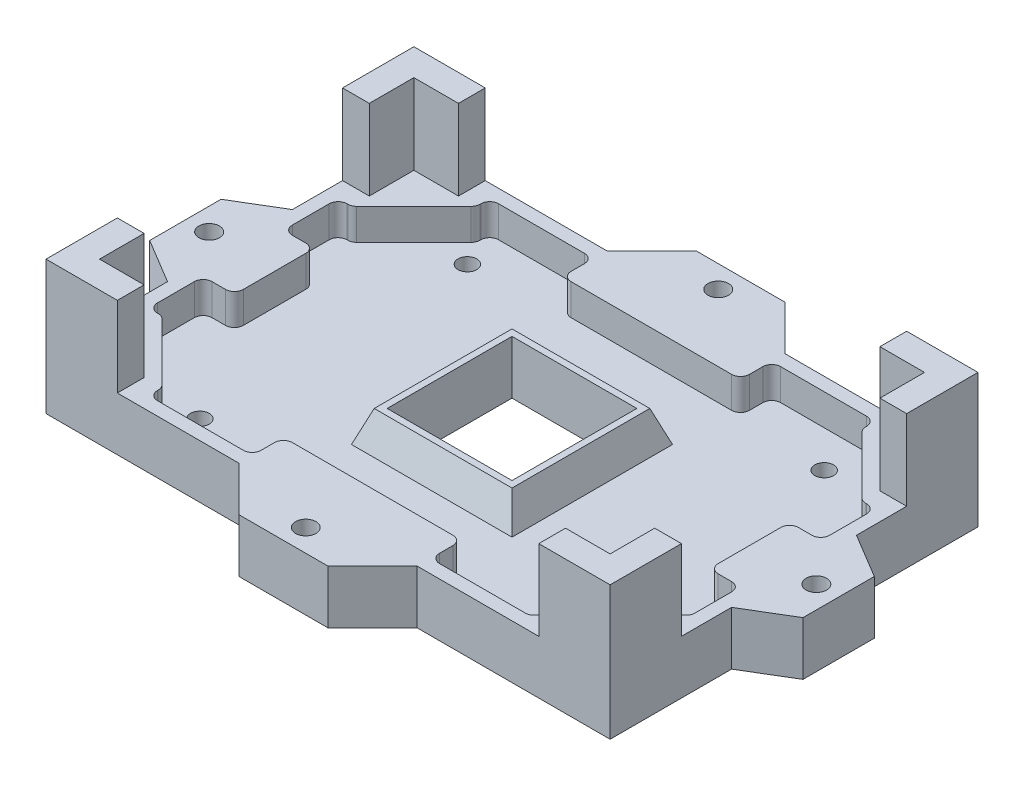
from build123d import *
from OCP.BRepFilletAPI import BRepFilletAPI_MakeChamfer

# Parameters (mm, degrees)
SKETCH_1_W       = 126.5
SKETCH_1_H       = 82.5
SKETCH_1_R       = 2.1
SKETCH_1_W_2     = 28
SKETCH_1_H_2     = 28
EXTRUDE_1_DEPTH  = 5
SKETCH_2_W       = 23.25
SKETCH_2_H       = 3
SKETCH_2_W_2     = 40
SKETCH_2_H_2     = 10
SKETCH_2_W_3     = 3
SKETCH_2_H_3     = 12.25
SKETCH_2_W_4     = 10
SKETCH_2_H_4     = 18
SKETCH_2_W_5     = 36
SKETCH_2_H_5     = 36
SKETCH_2_W_6     = 28
SKETCH_2_H_6     = 28
EXTRUDE_2_DEPTH  = 7
CHAMFER_1_SIZE   = 2.54779164
CHAMFER_1_SIZE_2 = 7
FILLET_1_R       = 2
EXTRUDE_3_DEPTH  = 18
SKETCH_4_W       = 20
SKETCH_4_H       = 10
SKETCH_4_R       = 2.3
SKETCH_4_W_2     = 10
SKETCH_4_H_2     = 16
EXTRUDE_4_DEPTH  = 12


with BuildPart() as part:
    # Эскиз1 → Бобышка-Вытянуть1 (new body)
    with BuildSketch(Plane(origin=(0, 77.195974268, 0), x_dir=(1, 0, 0), z_dir=(0, 1, 0))):
        with Locations((64.808980694, -89.523129836)):
            Rectangle(SKETCH_1_W, SKETCH_1_H)
        with Locations(Location((24.808980694, -59.523129836, 0), (0, 0, 180))):
            Circle(SKETCH_1_R, mode=Mode.SUBTRACT)
        with Locations(Location((104.808980694, -59.523129836, 0), (0, 0, 180))):
            Circle(SKETCH_1_R, mode=Mode.SUBTRACT)
        with Locations(Location((104.808980694, -119.523129836, 0), (0, 0, 180))):
            Circle(SKETCH_1_R, mode=Mode.SUBTRACT)
        with Locations(Location((24.808980694, -119.523129836, 0), (0, 0, 180))):
            Circle(SKETCH_1_R, mode=Mode.SUBTRACT)
        with Locations((64.808980694, -89.523129836)):
            Rectangle(SKETCH_1_W_2, SKETCH_1_H_2, mode=Mode.SUBTRACT)
    extrude(amount=EXTRUDE_1_DEPTH)

    # Эскиз2 → Бобышка-Вытянуть2 (add)
    # profile 1 of 17: a face of its own
    with BuildSketch(Plane(origin=(0, 82.195974268, 0), x_dir=(1, 0, 0), z_dir=(0, 1, 0))):
        Polygon((1.558980694, -68.273129836), (7.558980694, -68.273129836), (21.558980694, -54.273129836), (21.558980694, -48.273129836), (1.558980694, -48.273129836), align=None)
    # profile 2 of 17: a face of its own
    with BuildSketch(Plane(origin=(0, 82.195974268, 0), x_dir=(1, 0, 0), z_dir=(0, 1, 0))):
        with Locations((33.183980694, -49.773129836)):
            Rectangle(SKETCH_2_W, SKETCH_2_H)
    # profile 3 of 17: a face of its own
    with BuildSketch(Plane(origin=(0, 82.195974268, 0), x_dir=(1, 0, 0), z_dir=(0, 1, 0))):
        with Locations((64.808980694, -53.273129836)):
            Rectangle(SKETCH_2_W_2, SKETCH_2_H_2)
    # profile 4 of 17: a face of its own
    with BuildSketch(Plane(origin=(0, 82.195974268, 0), x_dir=(1, 0, 0), z_dir=(0, 1, 0))):
        with Locations((96.433980694, -49.773129836)):
            Rectangle(SKETCH_2_W, SKETCH_2_H)
    # profile 5 of 17: a face of its own
    with BuildSketch(Plane(origin=(0, 82.195974268, 0), x_dir=(1, 0, 0), z_dir=(0, 1, 0))):
        Polygon((122.058980694, -68.273129836), (108.058980694, -54.273129836), (108.058980694, -48.273129836), (128.058980694, -48.273129836), (128.058980694, -68.273129836), align=None)
    # profile 6 of 17: a face of its own
    with BuildSketch(Plane(origin=(0, 82.195974268, 0), x_dir=(1, 0, 0), z_dir=(0, 1, 0))):
        with Locations((126.558980694, -74.398129836)):
            Rectangle(SKETCH_2_W_3, SKETCH_2_H_3)
    # profile 7 of 17: a face of its own
    with BuildSketch(Plane(origin=(0, 82.195974268, 0), x_dir=(1, 0, 0), z_dir=(0, 1, 0))):
        with Locations((123.058980694, -89.523129836)):
            Rectangle(SKETCH_2_W_4, SKETCH_2_H_4)
    # profile 8 of 17: a face of its own
    with BuildSketch(Plane(origin=(0, 82.195974268, 0), x_dir=(1, 0, 0), z_dir=(0, 1, 0))):
        with Locations((126.558980694, -104.648129836)):
            Rectangle(SKETCH_2_W_3, SKETCH_2_H_3)
    # profile 9 of 17: a face of its own
    with BuildSketch(Plane(origin=(0, 82.195974268, 0), x_dir=(1, 0, 0), z_dir=(0, 1, 0))):
        Polygon((108.058980694, -124.773129836), (122.058980694, -110.773129836), (128.058980694, -110.773129836), (128.058980694, -130.773129836), (108.058980694, -130.773129836), align=None)
    # profile 10 of 17: a face of its own
    with BuildSketch(Plane(origin=(0, 82.195974268, 0), x_dir=(1, 0, 0), z_dir=(0, 1, 0))):
        with Locations((96.433980694, -129.273129836)):
            Rectangle(SKETCH_2_W, SKETCH_2_H)
    # profile 11 of 17: a face of its own
    with BuildSketch(Plane(origin=(0, 82.195974268, 0), x_dir=(1, 0, 0), z_dir=(0, 1, 0))):
        with Locations((64.808980694, -89.523129836)):
            Rectangle(SKETCH_2_W_5, SKETCH_2_H_5)
        with Locations((64.808980694, -89.523129836)):
            Rectangle(SKETCH_2_W_6, SKETCH_2_H_6, mode=Mode.SUBTRACT)
    # profile 12 of 17: a face of its own
    with BuildSketch(Plane(origin=(0, 82.195974268, 0), x_dir=(1, 0, 0), z_dir=(0, 1, 0))):
        with Locations((64.808980694, -125.773129836)):
            Rectangle(SKETCH_2_W_2, SKETCH_2_H_2)
    # profile 13 of 17: a face of its own
    with BuildSketch(Plane(origin=(0, 82.195974268, 0), x_dir=(1, 0, 0), z_dir=(0, 1, 0))):
        with Locations((33.183980694, -129.273129836)):
            Rectangle(SKETCH_2_W, SKETCH_2_H)
    # profile 14 of 17: a face of its own
    with BuildSketch(Plane(origin=(0, 82.195974268, 0), x_dir=(1, 0, 0), z_dir=(0, 1, 0))):
        Polygon((7.558980694, -110.773129836), (21.558980694, -124.773129836), (21.558980694, -130.773129836), (1.558980694, -130.773129836), (1.558980694, -110.773129836), align=None)
    # profile 15 of 17: a face of its own
    with BuildSketch(Plane(origin=(0, 82.195974268, 0), x_dir=(1, 0, 0), z_dir=(0, 1, 0))):
        with Locations((3.058980694, -104.648129836)):
            Rectangle(SKETCH_2_W_3, SKETCH_2_H_3)
    # profile 16 of 17: a face of its own
    with BuildSketch(Plane(origin=(0, 82.195974268, 0), x_dir=(1, 0, 0), z_dir=(0, 1, 0))):
        with Locations((6.558980694, -89.523129836)):
            Rectangle(SKETCH_2_W_4, SKETCH_2_H_4)
    # profile 17 of 17: a face of its own
    with BuildSketch(Plane(origin=(0, 82.195974268, 0), x_dir=(1, 0, 0), z_dir=(0, 1, 0))):
        with Locations((3.058980694, -74.398129836)):
            Rectangle(SKETCH_2_W_3, SKETCH_2_H_3)
    extrude(amount=EXTRUDE_2_DEPTH)

    # Фаска1
    chamfer_1_edges_1 = [part.edges().sort_by_distance(p)[0] for p in [
        (82.808980694, 89.195974268, 89.523129836),
    ]]
    chamfer_1_side_1 = [part.faces().sort_by_distance(p)[0] for p in [
        (82.758024861, 89.195974268, 89.523129836),
    ]]
    chamfer_1_edges_2 = [part.edges().sort_by_distance(p)[0] for p in [
        (64.808980694, 89.195974268, 71.523129836),
    ]]
    chamfer_1_side_2 = [part.faces().sort_by_distance(p)[0] for p in [
        (64.808980694, 89.195974268, 71.574085669),
    ]]
    chamfer_1_edges_3 = [part.edges().sort_by_distance(p)[0] for p in [
        (46.808980694, 89.195974268, 89.523129836),
    ]]
    chamfer_1_side_3 = [part.faces().sort_by_distance(p)[0] for p in [
        (46.859936527, 89.195974268, 89.523129836),
    ]]
    chamfer_1_edges_4 = [part.edges().sort_by_distance(p)[0] for p in [
        (64.808980694, 89.195974268, 107.523129836),
    ]]
    chamfer_1_side_4 = [part.faces().sort_by_distance(p)[0] for p in [
        (64.808980694, 89.195974268, 107.472174004),
    ]]
    chamfer_1 = BRepFilletAPI_MakeChamfer(part.part.solid().wrapped)
    for e in chamfer_1_edges_1:
        chamfer_1.Add(CHAMFER_1_SIZE - 0.0001, CHAMFER_1_SIZE_2 - 0.0001, e.wrapped, chamfer_1_side_1[0].wrapped)
    for e in chamfer_1_edges_2:
        chamfer_1.Add(CHAMFER_1_SIZE - 0.0001, CHAMFER_1_SIZE_2 - 0.0001, e.wrapped, chamfer_1_side_2[0].wrapped)
    for e in chamfer_1_edges_3:
        chamfer_1.Add(CHAMFER_1_SIZE - 0.0001, CHAMFER_1_SIZE_2 - 0.0001, e.wrapped, chamfer_1_side_3[0].wrapped)
    for e in chamfer_1_edges_4:
        chamfer_1.Add(CHAMFER_1_SIZE - 0.0001, CHAMFER_1_SIZE_2 - 0.0001, e.wrapped, chamfer_1_side_4[0].wrapped)
    add(Compound.cast(chamfer_1.Shape()), mode=Mode.REPLACE)  # a hair under: the kernel refuses the full size

    # Скругление1
    fillet_1_edges = [part.edges().sort_by_distance(p)[0] for p in [
        (108.058980694, 85.695974268, 124.773129836),
        (108.058980694, 85.695974268, 127.773129836),
        (84.808980694, 85.695974268, 127.773129836),
        (84.808980694, 85.695974268, 120.773129836),
        (44.808980694, 85.695974268, 120.773129836),
        (44.808980694, 85.695974268, 127.773129836),
        (21.558980694, 85.695974268, 127.773129836),
        (21.558980694, 85.695974268, 124.773129836),
        (7.558980694, 85.695974268, 110.773129836),
        (4.558980694, 85.695974268, 110.773129836),
        (4.558980694, 85.695974268, 98.523129836),
        (11.558980694, 85.695974268, 98.523129836),
        (11.558980694, 85.695974268, 80.523129836),
        (4.558980694, 85.695974268, 80.523129836),
        (4.558980694, 85.695974268, 68.273129836),
        (7.558980694, 85.695974268, 68.273129836),
        (21.558980694, 85.695974268, 54.273129836),
        (21.558980694, 85.695974268, 51.273129836),
        (44.808980694, 85.695974268, 51.273129836),
        (44.808980694, 85.695974268, 58.273129836),
        (84.808980694, 85.695974268, 58.273129836),
        (84.808980694, 85.695974268, 51.273129836),
        (108.058980694, 85.695974268, 51.273129836),
        (108.058980694, 85.695974268, 54.273129836),
        (122.058980694, 85.695974268, 68.273129836),
        (125.058980694, 85.695974268, 68.273129836),
        (125.058980694, 85.695974268, 80.523129836),
        (118.058980694, 85.695974268, 80.523129836),
        (118.058980694, 85.695974268, 98.523129836),
        (125.058980694, 85.695974268, 98.523129836),
        (125.058980694, 85.695974268, 110.773129836),
        (122.058980694, 85.695974268, 110.773129836),
    ]]
    fillet(fillet_1_edges, radius=FILLET_1_R)

    # Эскиз3 → Бобышка-Вытянуть3 (add)
    with BuildSketch(Plane(origin=(0, 89.195974268, 0), x_dir=(1, 0, 0), z_dir=(0, 1, 0))):
        Polygon((1.558980694, -48.273129836), (1.558980694, -64.273129836), (7.558980694, -64.273129836), (7.558980694, -54.273129836), (17.558980694, -54.273129836), (17.558980694, -48.273129836), align=None)
        Polygon((1.558980694, -130.773129836), (1.558980694, -114.773129836), (7.558980694, -114.773129836), (7.558980694, -124.773129836), (17.558980694, -124.773129836), (17.558980694, -130.773129836), align=None)
        Polygon((128.058980694, -48.273129836), (128.058980694, -64.273129836), (122.058980694, -64.273129836), (122.058980694, -54.273129836), (112.058980694, -54.273129836), (112.058980694, -48.273129836), align=None)
        Polygon((128.058980694, -130.773129836), (128.058980694, -114.773129836), (122.058980694, -114.773129836), (122.058980694, -124.773129836), (112.058980694, -124.773129836), (112.058980694, -130.773129836), align=None)
    extrude(amount=EXTRUDE_3_DEPTH)

    # Эскиз4 → Бобышка-Вытянуть4 (add)
    # profile 1 of 12: a face of its own
    with BuildSketch(Plane(origin=(0, 89.195974268, 0), x_dir=(1, 0, 0), z_dir=(0, 1, 0))):
        Polygon((54.808980694, -140.773129836), (44.808980694, -130.773129836), (54.808980694, -130.773129836), align=None)
    # profile 2 of 12: a face of its own
    with BuildSketch(Plane(origin=(0, 89.195974268, 0), x_dir=(1, 0, 0), z_dir=(0, 1, 0))):
        with Locations((64.808980694, -135.773129836)):
            Rectangle(SKETCH_4_W, SKETCH_4_H)
        with Locations(Location((64.808980694, -135.773129836, 0), (0, 0, 180))):
            Circle(SKETCH_4_R, mode=Mode.SUBTRACT)
    # profile 3 of 12: a face of its own
    with BuildSketch(Plane(origin=(0, 89.195974268, 0), x_dir=(1, 0, 0), z_dir=(0, 1, 0))):
        Polygon((74.808980694, -140.773129836), (74.808980694, -130.773129836), (84.808980694, -130.773129836), align=None)
    # profile 4 of 12: a face of its own
    with BuildSketch(Plane(origin=(0, 89.195974268, 0), x_dir=(1, 0, 0), z_dir=(0, 1, 0))):
        Polygon((44.808980694, -48.273129836), (54.808980694, -38.273129836), (54.808980694, -48.273129836), align=None)
    # profile 5 of 12: a face of its own
    with BuildSketch(Plane(origin=(0, 89.195974268, 0), x_dir=(1, 0, 0), z_dir=(0, 1, 0))):
        with Locations((64.808980694, -43.273129836)):
            Rectangle(SKETCH_4_W, SKETCH_4_H)
        with Locations(Location((64.808980694, -43.273129836, 0), (0, 0, 180))):
            Circle(SKETCH_4_R, mode=Mode.SUBTRACT)
    # profile 6 of 12: a face of its own
    with BuildSketch(Plane(origin=(0, 89.195974268, 0), x_dir=(1, 0, 0), z_dir=(0, 1, 0))):
        Polygon((74.808980694, -48.273129836), (84.808980694, -48.273129836), (74.808980694, -38.273129836), align=None)
    # profile 7 of 12: a face of its own
    with BuildSketch(Plane(origin=(0, 89.195974268, 0), x_dir=(1, 0, 0), z_dir=(0, 1, 0))):
        Polygon((1.558980694, -81.523129836), (1.558980694, -75.523129836), (-8.441019306, -81.523129836), align=None)
    # profile 8 of 12: a face of its own
    with BuildSketch(Plane(origin=(0, 89.195974268, 0), x_dir=(1, 0, 0), z_dir=(0, 1, 0))):
        with Locations((-3.441019306, -89.523129836)):
            Rectangle(SKETCH_4_W_2, SKETCH_4_H_2)
        with Locations(Location((-3.441019306, -89.187817333, 0), (0, 0, 180))):
            Circle(SKETCH_4_R, mode=Mode.SUBTRACT)
    # profile 9 of 12: a face of its own
    with BuildSketch(Plane(origin=(0, 89.195974268, 0), x_dir=(1, 0, 0), z_dir=(0, 1, 0))):
        Polygon((1.558980694, -103.523129836), (-8.441019306, -97.523129836), (1.558980694, -97.523129836), align=None)
    # profile 10 of 12: a face of its own
    with BuildSketch(Plane(origin=(0, 89.195974268, 0), x_dir=(1, 0, 0), z_dir=(0, 1, 0))):
        Polygon((128.058980694, -81.523129836), (128.058980694, -75.523129836), (138.058980694, -81.523129836), align=None)
    # profile 11 of 12: a face of its own
    with BuildSketch(Plane(origin=(0, 89.195974268, 0), x_dir=(1, 0, 0), z_dir=(0, 1, 0))):
        with Locations((133.058980694, -89.523129836)):
            Rectangle(SKETCH_4_W_2, SKETCH_4_H_2)
        with Locations(Location((133.058980694, -89.523129836, 0), (0, 0, 180))):
            Circle(SKETCH_4_R, mode=Mode.SUBTRACT)
    # profile 12 of 12: a face of its own
    with BuildSketch(Plane(origin=(0, 89.195974268, 0), x_dir=(1, 0, 0), z_dir=(0, 1, 0))):
        Polygon((128.058980694, -97.523129836), (128.058980694, -103.523129836), (138.058980694, -97.523129836), align=None)
    extrude(amount=-EXTRUDE_4_DEPTH)


solid = part.part
